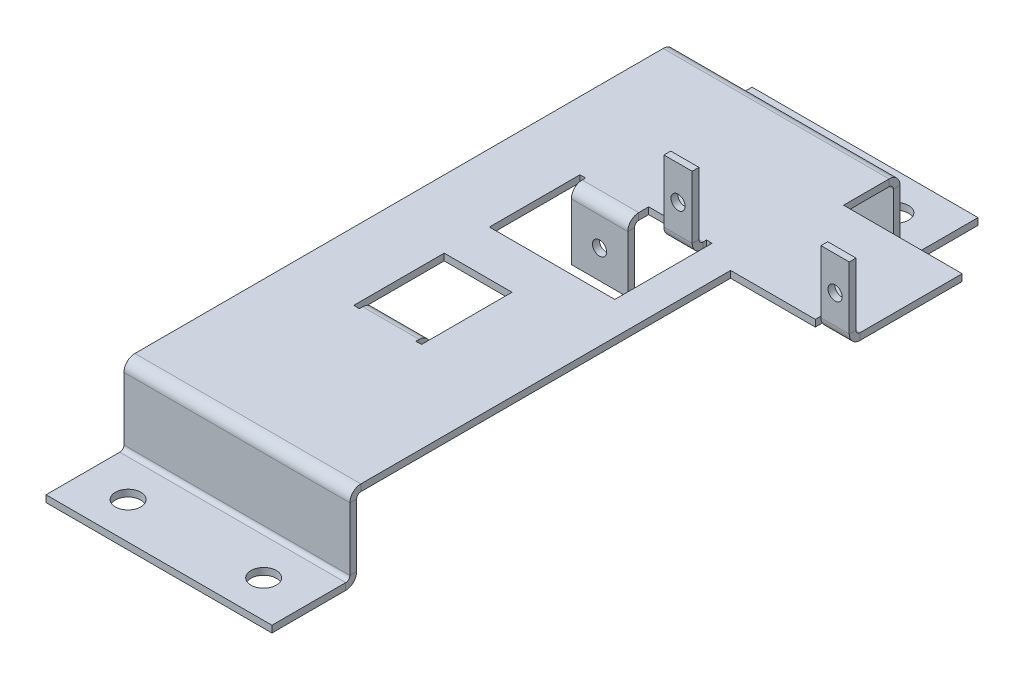
from build123d import *

# Parameters (mm, degrees)
SKETCH_1_W                       = 40
SKETCH_1_H                       = 15
SM_BASE_FLANGE_1_DEPTH           = 1.2
SM_EDGE_FLANGE_1_STRIP_W         = 6.2732
SM_EDGE_FLANGE_1_STRIP_H         = 1.2
SM_EDGE_FLANGE_1_STRIP_CUT_DEPTH = 40
SM_EDGE_FLANGE_1_DEPTH           = 40
SM_EDGE_FLANGE_2_STRIP_W         = 6.2732
SM_EDGE_FLANGE_2_STRIP_H         = 1.2
SM_EDGE_FLANGE_2_STRIP_CUT_DEPTH = 40
SM_EDGE_FLANGE_2_DEPTH           = 40
SM_EDGE_FLANGE_2_FLAT_DEPTH      = 1.2
SM_EDGE_FLANGE_3_STRIP_W         = 6.2732
SM_EDGE_FLANGE_3_STRIP_H         = 1.2
SM_EDGE_FLANGE_3_STRIP_CUT_DEPTH = 40
SM_EDGE_FLANGE_3_DEPTH           = 40
SM_EDGE_FLANGE_4_STRIP_W         = 6.2732
SM_EDGE_FLANGE_4_STRIP_H         = 1.2
SM_EDGE_FLANGE_4_STRIP_CUT_DEPTH = 40
SM_EDGE_FLANGE_4_DEPTH           = 40
CUT_EXTRUDE_1_DEPTH              = 10
SM_START                         = 13
SM_EDGE_FLANGE_5_DEPTH           = 10
SM_START_2                       = 12.4
SM_EDGE_FLANGE_5_2_OUTLINE_W     = 1.2
SM_EDGE_FLANGE_5_2_OUTLINE_H     = 0.0366
SM_EDGE_FLANGE_5_2_DEPTH         = 0.6
SM_START_3                       = 23
SM_EDGE_FLANGE_5_3_OUTLINE_W     = 1.2
SM_EDGE_FLANGE_5_3_OUTLINE_H     = 0.0366
SM_EDGE_FLANGE_5_3_DEPTH         = 0.6
SM_EDGE_FLANGE_5_4_DEPTH         = 10
SKETCH_26_R                      = 1.25
CUT_EXTRUDE_2_DEPTH              = 46
CUT_EXTRUDE_3_REACH              = 141.896
SKETCH_28_W                      = 1
SKETCH_28_H                      = 2.5
SM_START_4                       = 28.2
SM_EDGE_FLANGE_6_DEPTH           = 5
SM_START_5                       = 56
SM_EDGE_FLANGE_6_2_DEPTH         = 5
SM_START_6                       = 27.6
SM_EDGE_FLANGE_6_3_OUTLINE_W     = 1.2
SM_EDGE_FLANGE_6_3_OUTLINE_H     = 0.0366
SM_EDGE_FLANGE_6_3_DEPTH         = 0.6
SM_START_7                       = 33.2
SM_EDGE_FLANGE_6_4_OUTLINE_W     = 1.2
SM_EDGE_FLANGE_6_4_OUTLINE_H     = 0.0366
SM_EDGE_FLANGE_6_4_DEPTH         = 0.6
SM_START_8                       = 55.4
SM_EDGE_FLANGE_6_5_OUTLINE_W     = 1.2
SM_EDGE_FLANGE_6_5_OUTLINE_H     = 0.0366
SM_EDGE_FLANGE_6_5_DEPTH         = 0.6
SM_EDGE_FLANGE_6_6_DEPTH         = 5
SM_EDGE_FLANGE_6_7_DEPTH         = 5
CUT_EXTRUDE_4_REACH              = 106.737
SKETCH_35_R                      = 1.25
CUT_EXTRUDE_5_REACH              = 141.896
SKETCH_36_R                      = 2.25


# Read off the part's stored shape, not the designer's step: Ребро-кромка5, Ребро-кромка6
# Sheet-metal steps are written as plain solids
with BuildPart() as part:
    # Sketch 1 → Базовая кромка1 (new body)
    with BuildSketch(Plane(origin=(0, 0, 0), x_dir=(1, 0, 0), z_dir=(0, 1, 0))):
        with Locations((20, 7.5)):
            Rectangle(SKETCH_1_W, SKETCH_1_H)
    extrude(amount=-SM_BASE_FLANGE_1_DEPTH)

    # Ребро-кромка1 strip (across the edge) → Ребро-кромка1 strip cut (cut)
    with BuildSketch(Plane(origin=(40, 0, -15), x_dir=(0, 0, 1), z_dir=(-1, 0, 0))):
        with Locations((-1.2, -0.6)):
            Rectangle(SM_EDGE_FLANGE_1_STRIP_W, SM_EDGE_FLANGE_1_STRIP_H)
    extrude(amount=SM_EDGE_FLANGE_1_STRIP_CUT_DEPTH, mode=Mode.SUBTRACT)

    # Ребро-кромка1 section (across the edge) → Ребро-кромка1 (add)
    with BuildSketch(Plane(origin=(40, 0, -15), x_dir=(0, 0, 1), z_dir=(-1, 0, 0))):
        with BuildLine():
            Line((0, 0.7366), (0, 13.8))
            Line((0, 13.8), (1.2, 13.8))
            Line((1.2, 13.8), (1.2, 0.7366))
            ThreePointArc((1.2, 0.7366), (1.415745145, 0.215745145), (1.9366, 0))
            Line((1.9366, 0), (1.9366, -1.2))
            ThreePointArc((1.9366, -1.2), (0.567217008, -0.632782992), (0, 0.7366))
        make_face()
    extrude(amount=SM_EDGE_FLANGE_1_DEPTH)

    # Ребро-кромка2 strip (across the edge) → Ребро-кромка2 strip cut (cut)
    with BuildSketch(Plane(origin=(0, 13.8, -15), x_dir=(0, -1, 0), z_dir=(1, 0, 0))):
        with Locations((-1.2, -0.6)):
            Rectangle(SM_EDGE_FLANGE_2_STRIP_W, SM_EDGE_FLANGE_2_STRIP_H)
    extrude(amount=SM_EDGE_FLANGE_2_STRIP_CUT_DEPTH, mode=Mode.SUBTRACT)

    # Ребро-кромка2 bend section (across the edge) → Ребро-кромка2 (add)
    with BuildSketch(Plane(origin=(0, 13.8, -15), x_dir=(0, -1, 0), z_dir=(1, 0, 0))):
        with BuildLine():
            Line((0, 0.7366), (1.2, 0.7366))
            ThreePointArc((1.2, 0.7366), (1.415745145, 0.215745145), (1.9366, 0))
            Line((1.9366, 0), (1.9366, -1.2))
            ThreePointArc((1.9366, -1.2), (0.567217008, -0.632782992), (0, 0.7366))
        make_face()
    extrude(amount=SM_EDGE_FLANGE_2_DEPTH)

    # Ребро-кромка2 profile (on flange) → Ребро-кромка2 flat (add)
    with BuildSketch(Plane(origin=(0, 13.8, -15), x_dir=(1, 0, 0), z_dir=(0, 1, 0))):
        Polygon((0, 0.7366), (40, 0.7366), (40, 66.2), (61, 66.2), (61, 86.2), (40, 86.2), (40, 96.2), (0, 96.2), align=None)
    extrude(amount=-SM_EDGE_FLANGE_2_FLAT_DEPTH)

    # Ребро-кромка3 strip (across the edge) → Ребро-кромка3 strip cut (cut)
    with BuildSketch(Plane(origin=(0, 12.6, -111.2), x_dir=(0, 0, 1), z_dir=(1, 0, 0))):
        with Locations((-1.2, -0.6)):
            Rectangle(SM_EDGE_FLANGE_3_STRIP_W, SM_EDGE_FLANGE_3_STRIP_H)
    extrude(amount=SM_EDGE_FLANGE_3_STRIP_CUT_DEPTH, mode=Mode.SUBTRACT)

    # Ребро-кромка3 section (across the edge) → Ребро-кромка3 (add)
    with BuildSketch(Plane(origin=(0, 12.6, -111.2), x_dir=(0, 0, 1), z_dir=(1, 0, 0))):
        with BuildLine():
            Line((0, 0.7366), (0, 13.8))
            Line((0, 13.8), (1.2, 13.8))
            Line((1.2, 13.8), (1.2, 0.7366))
            ThreePointArc((1.2, 0.7366), (1.415745145, 0.215745145), (1.9366, 0))
            Line((1.9366, 0), (1.9366, -1.2))
            ThreePointArc((1.9366, -1.2), (0.567217008, -0.632782992), (0, 0.7366))
        make_face()
    extrude(amount=SM_EDGE_FLANGE_3_DEPTH)

    # Ребро-кромка4 strip (across the edge) → Ребро-кромка4 strip cut (cut)
    with BuildSketch(Plane(origin=(40, -1.2, -111.2), x_dir=(0, 1, 0), z_dir=(-1, 0, 0))):
        with Locations((-1.2, -0.6)):
            Rectangle(SM_EDGE_FLANGE_4_STRIP_W, SM_EDGE_FLANGE_4_STRIP_H)
    extrude(amount=SM_EDGE_FLANGE_4_STRIP_CUT_DEPTH, mode=Mode.SUBTRACT)

    # Ребро-кромка4 section (across the edge) → Ребро-кромка4 (add)
    with BuildSketch(Plane(origin=(40, -1.2, -111.2), x_dir=(0, 1, 0), z_dir=(-1, 0, 0))):
        with BuildLine():
            Line((0, 0.7366), (0, 13.8))
            Line((0, 13.8), (1.2, 13.8))
            Line((1.2, 13.8), (1.2, 0.7366))
            ThreePointArc((1.2, 0.7366), (1.415745145, 0.215745145), (1.9366, 0))
            Line((1.9366, 0), (1.9366, -1.2))
            ThreePointArc((1.9366, -1.2), (0.567217008, -0.632782992), (0, 0.7366))
        make_face()
    extrude(amount=SM_EDGE_FLANGE_4_DEPTH)

    # Эскиз19 → Вырез-Вытянуть1 (cut)
    with BuildSketch(Plane(origin=(0, 13.8, 0), x_dir=(1, 0, 0), z_dir=(0, 1, 0))):
        Polygon((13, 45), (23, 45), (23, 42.5), (24, 42.5), (24, 58.5), (12, 58.5), (12, 42.5), (13, 42.5), align=None)
        Polygon((12, 66.5), (24, 66.5), (24, 82.5), (23, 82.5), (23, 80), (13, 80), (13, 82.5), (12, 82.5), align=None)
    extrude(amount=-CUT_EXTRUDE_1_DEPTH, mode=Mode.SUBTRACT)

    # Ребро-кромка5 outline → Ребро-кромка5 (cut)
    with BuildSketch(Plane.YZ.offset(SM_START)):
        with BuildLine():
            ThreePointArc((12.6, -80.145555612), (13.472269031, -80.858657516), (13.8, -81.9366))
            Line((13.8, -81.9366), (13.8, -80))
            Line((13.8, -80), (12.6, -80))
            Line((12.6, -80), (12.6, -80.145555612))
        make_face()
        with BuildLine():
            Line((12.6, -45), (13.8, -45))
            Line((13.8, -45), (13.8, -43.0634))
            ThreePointArc((13.8, -43.0634), (13.472269031, -44.141342484), (12.6, -44.854444388))
            Line((12.6, -44.854444388), (12.6, -45))
        make_face()
    extrude(amount=SM_EDGE_FLANGE_5_DEPTH, mode=Mode.SUBTRACT)

    # Sm Edge Flange 5 2 outline → Sm Edge Flange 5 2 (cut)
    with BuildSketch(Plane.YZ.offset(SM_START_2)):
        with Locations((13.2, -82.5183)):
            Rectangle(SM_EDGE_FLANGE_5_2_OUTLINE_W, SM_EDGE_FLANGE_5_2_OUTLINE_H)
        with Locations((13.2, -42.4817)):
            Rectangle(SM_EDGE_FLANGE_5_2_OUTLINE_W, SM_EDGE_FLANGE_5_2_OUTLINE_H)
    extrude(amount=SM_EDGE_FLANGE_5_2_DEPTH, mode=Mode.SUBTRACT)

    # Sm Edge Flange 5 3 outline → Sm Edge Flange 5 3 (cut)
    with BuildSketch(Plane.YZ.offset(SM_START_3)):
        with Locations((13.2, -82.5183)):
            Rectangle(SM_EDGE_FLANGE_5_3_OUTLINE_W, SM_EDGE_FLANGE_5_3_OUTLINE_H)
        with Locations((13.2, -42.4817)):
            Rectangle(SM_EDGE_FLANGE_5_3_OUTLINE_W, SM_EDGE_FLANGE_5_3_OUTLINE_H)
    extrude(amount=SM_EDGE_FLANGE_5_3_DEPTH, mode=Mode.SUBTRACT)

    # Sm Edge Flange 5 4 outline → Sm Edge Flange 5 4 (add)
    with BuildSketch(Plane.YZ.offset(SM_START)):
        with BuildLine():
            ThreePointArc((11.8634, -81.2), (12.384254855, -81.415745145), (12.6, -81.9366))
            Line((12.6, -81.9366), (12.6, -80.145555612))
            ThreePointArc((12.6, -80.145555612), (12.238821762, -80.036737358), (11.8634, -80))
            Line((11.8634, -80), (1.8, -80))
            Line((1.8, -80), (1.8, -81.2))
            Line((1.8, -81.2), (11.8634, -81.2))
        make_face()
        with BuildLine():
            ThreePointArc((11.8634, -45), (12.238821762, -44.963262642), (12.6, -44.854444388))
            Line((12.6, -44.854444388), (12.6, -43.0634))
            ThreePointArc((12.6, -43.0634), (12.384254855, -43.584254855), (11.8634, -43.8))
            Line((11.8634, -43.8), (1.8, -43.8))
            Line((1.8, -43.8), (1.8, -45))
            Line((1.8, -45), (11.8634, -45))
        make_face()
    extrude(amount=SM_EDGE_FLANGE_5_4_DEPTH)

    # Эскиз26 → Вырез-Вытянуть2 (cut)
    with BuildSketch(Plane.XY.offset(-43.8)):
        with Locations((18, 6.8317)):
            Circle(SKETCH_26_R)
    extrude(amount=-CUT_EXTRUDE_2_DEPTH, mode=Mode.SUBTRACT)

    # Эскиз28 → Вырез-Вытянуть3 (cut, up to next)
    with BuildSketch(Plane(origin=(0, 13.8, 0), x_dir=(1, 0, 0), z_dir=(0, 1, 0)), mode=Mode.PRIVATE) as cut_extrude_3_sk1:
        with Locations((55.5, 82.45)):
            Rectangle(SKETCH_28_W, SKETCH_28_H)
    cut_extrude_3_tool1 = extrude(cut_extrude_3_sk1.sketch, amount=-CUT_EXTRUDE_3_REACH, mode=Mode.PRIVATE) & part.part
    # Эскиз28 → Вырез-Вытянуть3 (cut, up to next)
    with BuildSketch(Plane(origin=(0, 13.8, 0), x_dir=(1, 0, 0), z_dir=(0, 1, 0)), mode=Mode.PRIVATE) as cut_extrude_3_sk2:
        Polygon((28.2, 81.2), (33.2, 81.2), (33.2, 83.7), (34.2, 83.7), (34.2, 66.5), (23, 66.5), (23, 83.7), (28.2, 83.7), align=None)
    cut_extrude_3_tool2 = extrude(cut_extrude_3_sk2.sketch, amount=-CUT_EXTRUDE_3_REACH, mode=Mode.PRIVATE) & part.part
    add(cut_extrude_3_tool1.solids().sort_by_distance((55.5, 13.8, -82.45))[0], mode=Mode.SUBTRACT)
    add(cut_extrude_3_tool2.solids().sort_by_distance((28.45428, 13.8, -74.58998))[0], mode=Mode.SUBTRACT)

    # Ребро-кромка6 outline → Ребро-кромка6 (cut)
    with BuildSketch(Plane.YZ.offset(SM_START_4)):
        with BuildLine():
            ThreePointArc((12.6, -83.1366), (12.927730969, -82.058657516), (13.8, -81.345555612))
            Line((13.8, -81.345555612), (13.8, -81.2))
            Line((13.8, -81.2), (12.6, -81.2))
            Line((12.6, -81.2), (12.6, -83.1366))
        make_face()
    extrude(amount=SM_EDGE_FLANGE_6_DEPTH, mode=Mode.SUBTRACT)

    # Sm Edge Flange 6 2 outline → Sm Edge Flange 6 2 (cut)
    with BuildSketch(Plane.YZ.offset(SM_START_5)):
        with BuildLine():
            ThreePointArc((12.6, -83.1366), (12.927730969, -82.058657516), (13.8, -81.345555612))
            Line((13.8, -81.345555612), (13.8, -81.2))
            Line((13.8, -81.2), (12.6, -81.2))
            Line((12.6, -81.2), (12.6, -83.1366))
        make_face()
    extrude(amount=SM_EDGE_FLANGE_6_2_DEPTH, mode=Mode.SUBTRACT)

    # Sm Edge Flange 6 3 outline → Sm Edge Flange 6 3 (cut)
    with BuildSketch(Plane.YZ.offset(SM_START_6)):
        with Locations((13.2, -83.7183)):
            Rectangle(SM_EDGE_FLANGE_6_3_OUTLINE_W, SM_EDGE_FLANGE_6_3_OUTLINE_H)
    extrude(amount=SM_EDGE_FLANGE_6_3_DEPTH, mode=Mode.SUBTRACT)

    # Sm Edge Flange 6 4 outline → Sm Edge Flange 6 4 (cut)
    with BuildSketch(Plane.YZ.offset(SM_START_7)):
        with Locations((13.2, -83.7183)):
            Rectangle(SM_EDGE_FLANGE_6_4_OUTLINE_W, SM_EDGE_FLANGE_6_4_OUTLINE_H)
    extrude(amount=SM_EDGE_FLANGE_6_4_DEPTH, mode=Mode.SUBTRACT)

    # Sm Edge Flange 6 5 outline → Sm Edge Flange 6 5 (cut)
    with BuildSketch(Plane.YZ.offset(SM_START_8)):
        with Locations((13.2, -83.7183)):
            Rectangle(SM_EDGE_FLANGE_6_5_OUTLINE_W, SM_EDGE_FLANGE_6_5_OUTLINE_H)
    extrude(amount=SM_EDGE_FLANGE_6_5_DEPTH, mode=Mode.SUBTRACT)

    # Sm Edge Flange 6 6 outline → Sm Edge Flange 6 6 (add)
    with BuildSketch(Plane.YZ.offset(SM_START_4)):
        with BuildLine():
            Line((25.6, -81.2), (14.5366, -81.2))
            ThreePointArc((14.5366, -81.2), (14.161178238, -81.236737358), (13.8, -81.345555612))
            Line((13.8, -81.345555612), (13.8, -83.1366))
            ThreePointArc((13.8, -83.1366), (14.015745145, -82.615745145), (14.5366, -82.4))
            Line((14.5366, -82.4), (25.6, -82.4))
            Line((25.6, -82.4), (25.6, -81.2))
        make_face()
    extrude(amount=SM_EDGE_FLANGE_6_6_DEPTH)

    # Sm Edge Flange 6 7 outline → Sm Edge Flange 6 7 (add)
    with BuildSketch(Plane.YZ.offset(SM_START_5)):
        with BuildLine():
            Line((25.6, -81.2), (14.5366, -81.2))
            ThreePointArc((14.5366, -81.2), (14.161178238, -81.236737358), (13.8, -81.345555612))
            Line((13.8, -81.345555612), (13.8, -83.1366))
            ThreePointArc((13.8, -83.1366), (14.015745145, -82.615745145), (14.5366, -82.4))
            Line((14.5366, -82.4), (25.6, -82.4))
            Line((25.6, -82.4), (25.6, -81.2))
        make_face()
    extrude(amount=SM_EDGE_FLANGE_6_7_DEPTH)

    # Эскиз35 → Вырез-Вытянуть4 (cut, up to next)
    with BuildSketch(Plane.XY.offset(-81.2), mode=Mode.PRIVATE) as cut_extrude_4_sk1:
        with Locations((30.7, 19.6)):
            Circle(SKETCH_35_R)
    cut_extrude_4_tool1 = extrude(cut_extrude_4_sk1.sketch, amount=-CUT_EXTRUDE_4_REACH, mode=Mode.PRIVATE) & part.part
    # Эскиз35 → Вырез-Вытянуть4 (cut, up to next)
    with BuildSketch(Plane.XY.offset(-81.2), mode=Mode.PRIVATE) as cut_extrude_4_sk2:
        with Locations((58.5, 19.6)):
            Circle(SKETCH_35_R)
    cut_extrude_4_tool2 = extrude(cut_extrude_4_sk2.sketch, amount=-CUT_EXTRUDE_4_REACH, mode=Mode.PRIVATE) & part.part
    add(cut_extrude_4_tool1.solids().sort_by_distance((30.7, 19.6, -81.2))[0], mode=Mode.SUBTRACT)
    add(cut_extrude_4_tool2.solids().sort_by_distance((58.5, 19.6, -81.2))[0], mode=Mode.SUBTRACT)

    # Эскиз36 → Вырез-Вытянуть5 (cut, up to next)
    with BuildSketch(Plane(origin=(0, 13.8, 0), x_dir=(1, 0, 0), z_dir=(0, 1, 0)), mode=Mode.PRIVATE) as cut_extrude_5_sk1:
        with Locations(Location((8, 118.4683, 0), (0, 0, 270))):
            Circle(SKETCH_36_R)
    cut_extrude_5_tool1 = extrude(cut_extrude_5_sk1.sketch, amount=-CUT_EXTRUDE_5_REACH, mode=Mode.PRIVATE) & part.part
    # Эскиз36 → Вырез-Вытянуть5 (cut, up to next)
    with BuildSketch(Plane(origin=(0, 13.8, 0), x_dir=(1, 0, 0), z_dir=(0, 1, 0)), mode=Mode.PRIVATE) as cut_extrude_5_sk2:
        with Locations(Location((32, 118.4683, 0), (0, 0, 270))):
            Circle(SKETCH_36_R)
    cut_extrude_5_tool2 = extrude(cut_extrude_5_sk2.sketch, amount=-CUT_EXTRUDE_5_REACH, mode=Mode.PRIVATE) & part.part
    # Эскиз36 → Вырез-Вытянуть5 (cut, up to next)
    with BuildSketch(Plane(origin=(0, 13.8, 0), x_dir=(1, 0, 0), z_dir=(0, 1, 0)), mode=Mode.PRIVATE) as cut_extrude_5_sk3:
        with Locations(Location((8, 6.5317, 0), (0, 0, 90))):
            Circle(SKETCH_36_R)
    cut_extrude_5_tool3 = extrude(cut_extrude_5_sk3.sketch, amount=-CUT_EXTRUDE_5_REACH, mode=Mode.PRIVATE) & part.part
    # Эскиз36 → Вырез-Вытянуть5 (cut, up to next)
    with BuildSketch(Plane(origin=(0, 13.8, 0), x_dir=(1, 0, 0), z_dir=(0, 1, 0)), mode=Mode.PRIVATE) as cut_extrude_5_sk4:
        with Locations(Location((32, 6.5317, 0), (0, 0, 90))):
            Circle(SKETCH_36_R)
    cut_extrude_5_tool4 = extrude(cut_extrude_5_sk4.sketch, amount=-CUT_EXTRUDE_5_REACH, mode=Mode.PRIVATE) & part.part
    add(cut_extrude_5_tool1.solids().sort_by_distance((8, 13.8, -118.4683))[0], mode=Mode.SUBTRACT)
    add(cut_extrude_5_tool2.solids().sort_by_distance((32, 13.8, -118.4683))[0], mode=Mode.SUBTRACT)
    add(cut_extrude_5_tool3.solids().sort_by_distance((8, 13.8, -6.5317))[0], mode=Mode.SUBTRACT)
    add(cut_extrude_5_tool4.solids().sort_by_distance((32, 13.8, -6.5317))[0], mode=Mode.SUBTRACT)


solid = part.part
